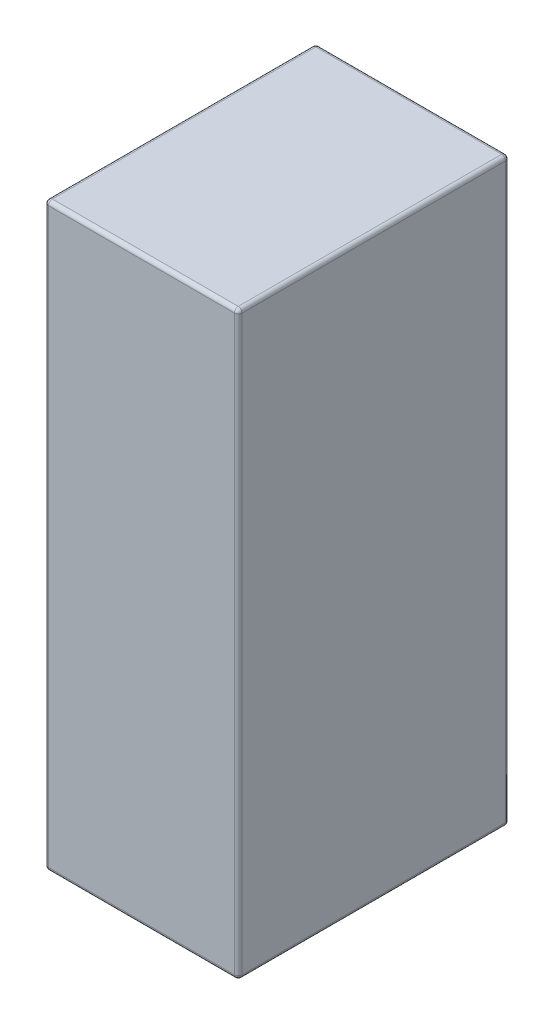
from build123d import *

# Parameters (mm, degrees)
SKETCH1_W           = 50
SKETCH1_H           = 70
BOSS_EXTRUDE1_DEPTH = 75
FILLET1_R           = 1


with BuildPart() as part:
    # Sketch1 → Boss-Extrude1 (new, symmetric)
    with BuildSketch(Plane(origin=(0, 0, 0), x_dir=(1, 0, 0), z_dir=(0, 1, 0))):
        Rectangle(SKETCH1_W, SKETCH1_H)
    extrude(amount=BOSS_EXTRUDE1_DEPTH, both=True)

    # Fillet1
    fillet1_edges = [part.edges().sort_by_distance(p)[0] for p in [
        (25, 0, -35),
        (-25, 0, -35),
        (-25, 0, 35),
        (25, 0, 35),
        (0, -75, -35),
        (-25, -75, 0),
        (0, -75, 35),
        (25, -75, 0),
        (0, 75, 35),
        (-25, 75, 0),
        (0, 75, -35),
        (25, 75, 0),
    ]]
    fillet(fillet1_edges, radius=FILLET1_R)


solid = part.part
